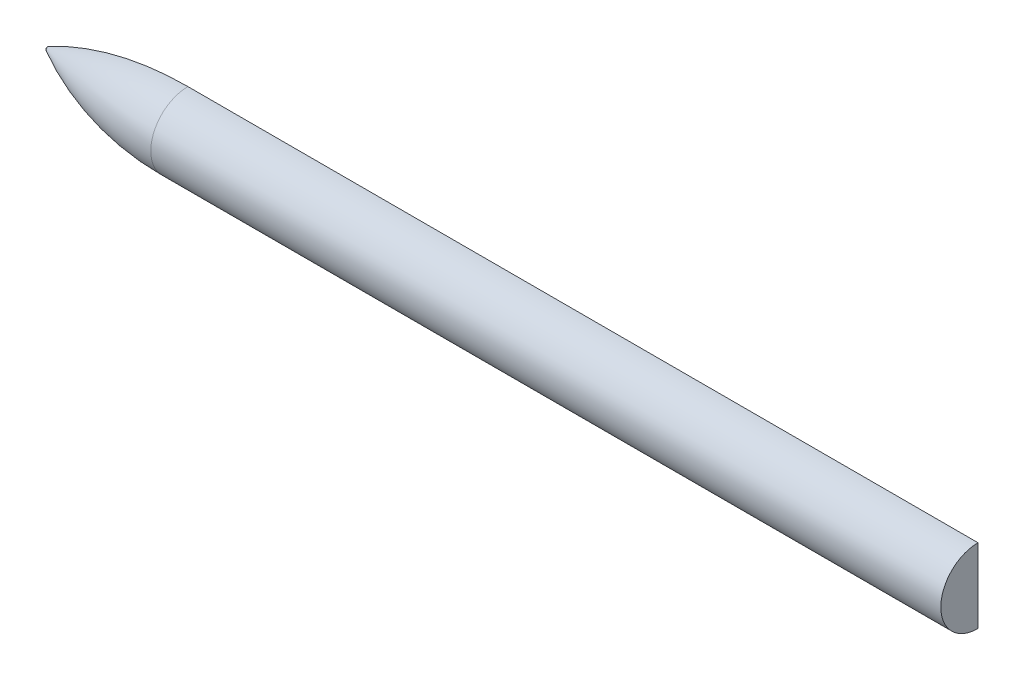
from build123d import *

# Parameters (mm, degrees)
REVOLVE1_ANGLE = 180


with BuildPart() as part:
    # Sketch1 → Revolve1 (revolve)
    with BuildSketch(Plane.XY):
        with BuildLine():
            Line((500, 0), (500, 40))
            Line((500, 40), (-350, 40))
            ThreePointArc((-350, 40), (-427.30823048, 30.482921921), (-500, 2.5))
            ThreePointArc((-500, 2.5), (-501.257357908, 1.455886326), (-502, 0))
            Line((-502, 0), (500, 0))
        make_face()
    revolve(axis=Axis((-668.954225757, 0, 0), (1, 0, 0)), revolution_arc=REVOLVE1_ANGLE)


solid = part.part
